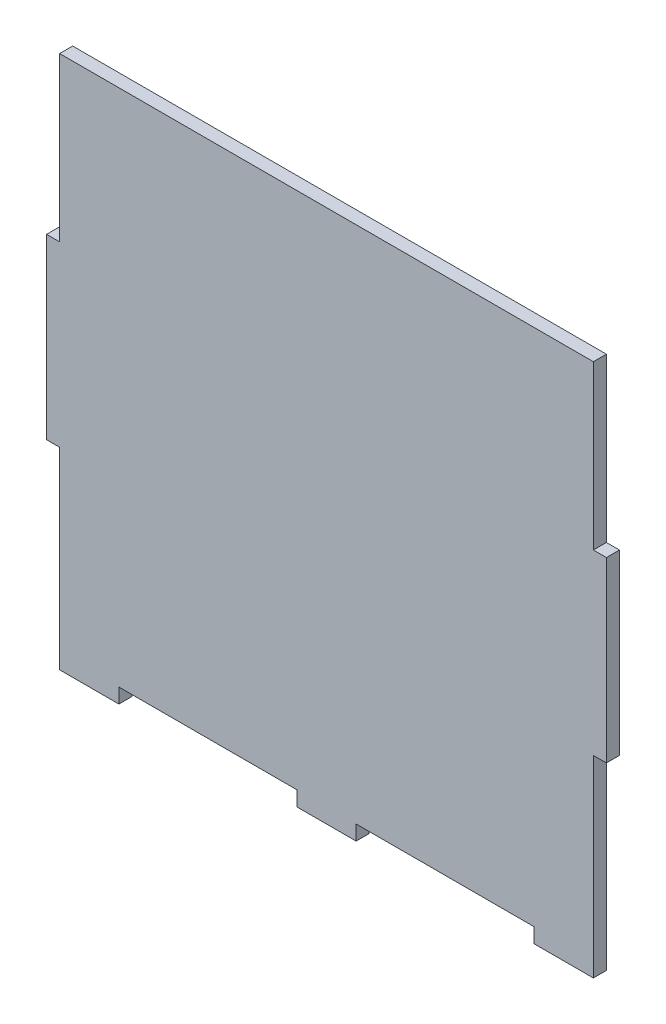
from build123d import *

# Parameters (mm, degrees)
BOSS_EXTRUDE1_DEPTH = 5.588


with BuildPart() as part:
    # Sketch1 → Boss-Extrude1 (new body)
    with BuildSketch(Plane.XY):
        Polygon((118.491, 181.238830039), (-110.109, 181.238830039), (-110.109, 111.388830039), (-115.697, 111.388830039), (-115.697, 35.188830039), (-110.109, 35.188830039), (-110.109, -47.361169961), (-84.709, -47.361169961), (-84.709, -41.03624), (-8.509, -41.03624), (-8.509, -47.38624), (16.891, -47.38624), (16.891, -41.03624), (93.091, -41.03624), (93.091, -47.361169961), (118.491, -47.361169961), (118.491, 35.188830039), (124.079, 35.188830039), (124.079, 111.388830039), (118.491, 111.388830039), align=None)
    extrude(amount=BOSS_EXTRUDE1_DEPTH)


solid = part.part
